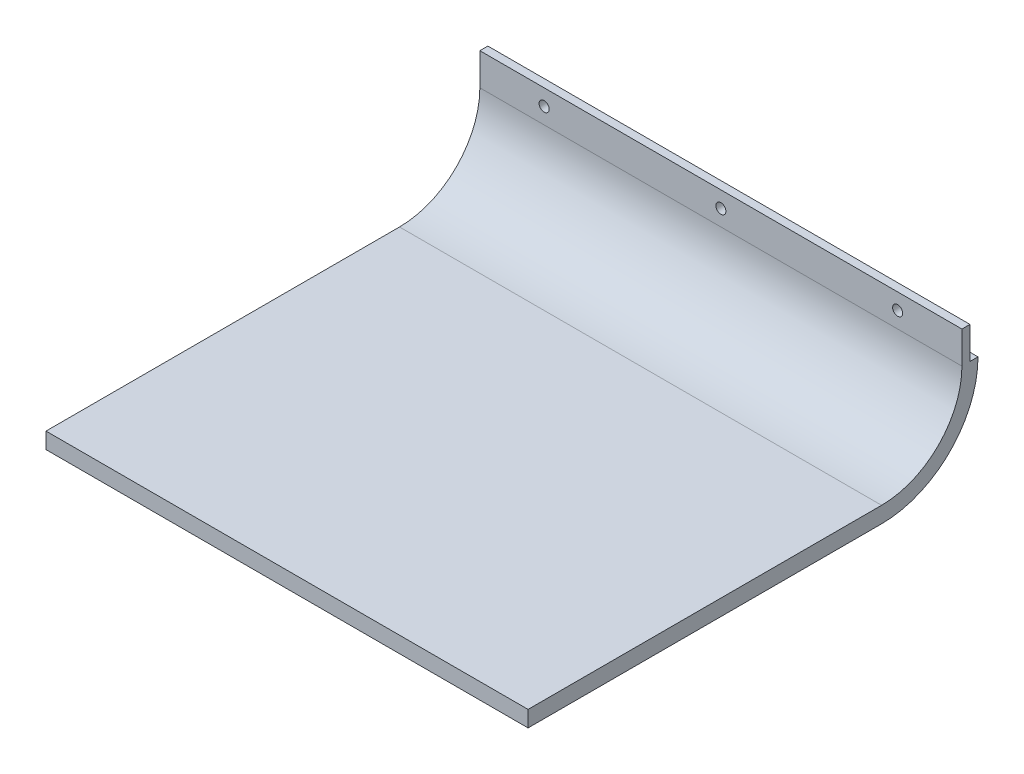
from build123d import *

# Parameters (mm, degrees)
BOSS_EXTRUDE1_DEPTH      = 190.5
BOSS_EXTRUDE1_DEPTH_BACK = 190.5
SKETCH2_W                = 381
SKETCH2_H                = 6.35
BOSS_EXTRUDE2_DEPTH      = 25.4
SKETCH3_R                = 3.96875
CUT_EXTRUDE1_DEPTH       = 25.4


with BuildPart() as part:
    # Sketch1 → Boss-Extrude1 (new, two sides: drawn at the far end of the back side and taken through both)
    with BuildSketch(Plane(origin=(0, 0, 0), x_dir=(0, 0, -1), z_dir=(1, 0, 0)).offset(-BOSS_EXTRUDE1_DEPTH_BACK)):
        with BuildLine():
            Line((-139.7, 0), (139.7, 0))
            ThreePointArc((139.7, 0), (193.581536726, 22.318463274), (215.9, 76.2))
            Line((215.9, 76.2), (203.2, 76.2))
            ThreePointArc((203.2, 76.2), (184.601280605, 31.298719395), (139.7, 12.7))
            Line((139.7, 12.7), (-139.7, 12.7))
            Line((-139.7, 12.7), (-139.7, 0))
        make_face()
    extrude(amount=BOSS_EXTRUDE1_DEPTH + BOSS_EXTRUDE1_DEPTH_BACK)

    # Sketch2 → Boss-Extrude2 (add)
    with BuildSketch(Plane(origin=(0, 76.2, 0), x_dir=(1, 0, 0), z_dir=(0, 1, 0))):
        with Locations((0, 206.375)):
            Rectangle(SKETCH2_W, SKETCH2_H)
    extrude(amount=BOSS_EXTRUDE2_DEPTH)

    # Sketch3 → Cut-Extrude1 (cut)
    with BuildSketch(Plane(origin=(0, 0, -209.55), x_dir=(-1, 0, 0), z_dir=(0, 0, -1))):
        with Locations((-139.7, 88.9)):
            Circle(SKETCH3_R)
        with Locations((139.7, 88.9)):
            Circle(SKETCH3_R)
        with Locations((0, 88.9)):
            Circle(SKETCH3_R)
    extrude(amount=-CUT_EXTRUDE1_DEPTH, mode=Mode.SUBTRACT)


solid = part.part
